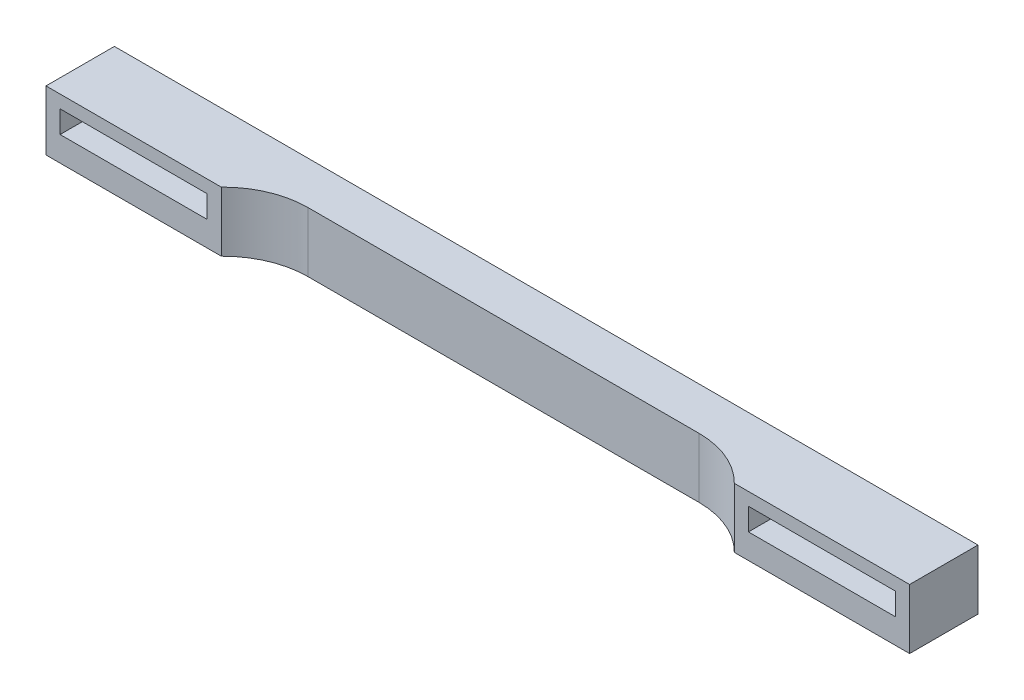
from build123d import *

# Parameters (mm, degrees)
SKETCH2_W           = 60
SKETCH2_H           = 5
BOSS_EXTRUDE1_DEPTH = 7
CUT_EXTRUDE1_DEPTH  = 12
SKETCH5_R           = 1.4
CUT_EXTRUDE2_DEPTH  = 3
FILLET1_R           = 10
FILLET2_R           = 0.3


with BuildPart() as part:
    # Sketch2 → Boss-Extrude1 (new body)
    with BuildSketch(Plane(origin=(0, 0, 0), x_dir=(1, 0, 0), z_dir=(0, 1, 0))):
        Polygon((-50.5, 5), (-30, 5), (-30, 0), (-30, -3), (-50.5, -3), align=None)
        with Locations((0, 2.5)):
            Rectangle(SKETCH2_W, SKETCH2_H)
        Polygon((30, -3), (30, 0), (30, 5), (50.5, 5), (50.5, -3), align=None)
    extrude(amount=BOSS_EXTRUDE1_DEPTH)

    # Sketch4 → Cut-Extrude1 (cut)
    with BuildSketch(Plane.XY.offset(3)):
        Polygon((-31.65, 2.9), (-31.65, 5.5), (-40.25, 5.5), (-48.85, 5.5), (-48.85, 2.9), align=None)
        Polygon((48.85, 2.9), (31.65, 2.9), (31.65, 5.5), (40.25, 5.5), (48.85, 5.5), align=None)
    extrude(amount=-CUT_EXTRUDE1_DEPTH, mode=Mode.SUBTRACT)

    # Sketch5 → Cut-Extrude2 (cut)
    with BuildSketch(Plane.XZ):
        with Locations(Location((40.25, -1, 0), (0, 0, 270))):
            Circle(SKETCH5_R)
        with Locations(Location((-40.25, -1, 0), (0, 0, 270))):
            Circle(SKETCH5_R)
    extrude(amount=-CUT_EXTRUDE2_DEPTH, mode=Mode.SUBTRACT)

    # Fillet1
    # the kernel refuses this fillet: 10 mm, written as the material it adds along each edge
    with BuildSketch(Plane(origin=(-30, 0, 0), x_dir=(0, 0, 1), z_dir=(0, 1, 0))) as fillet1_piece_1:
        with BuildLine():
            CenterArc((10, 7.141428429), FILLET1_R, 180, 45.572995999)
            Line((0, 7.141428429), (-0.2, 7.141428429))
            Line((-0.2, 7.141428429), (-0.2, 0))
            Line((-0.2, 0), (0, -0.2))
            ThreePointArc((0, -0.2), (1.5, -0.2), (2.86, -0.142828569))
            Line((2.86, -0.142828569), (3, 0))
        make_face()
    extrude(amount=7)
    with BuildSketch(Plane(origin=(30, 0, 0), x_dir=(0, 0, 1), z_dir=(0, 1, 0))) as fillet1_piece_2:
        with BuildLine():
            CenterArc((10, -7.141428429), FILLET1_R, 134.427004001, 45.572995999)
            Line((0, -7.141428429), (-0.2, -7.141428429))
            Line((-0.2, -7.141428429), (-0.2, 0))
            Line((-0.2, 0), (0, 0.2))
            ThreePointArc((0, 0.2), (1.5, 0.2), (2.86, 0.142828569))
            Line((2.86, 0.142828569), (3, 0))
        make_face()
    extrude(amount=7)

    # Fillet2
    fillet2_edges = [part.edges().sort_by_distance(p)[0] for p in [
        (40.25, 0, 0.4),
        (-40.25, 0, 0.4),
    ]]
    fillet(fillet2_edges, radius=FILLET2_R)


solid = part.part
